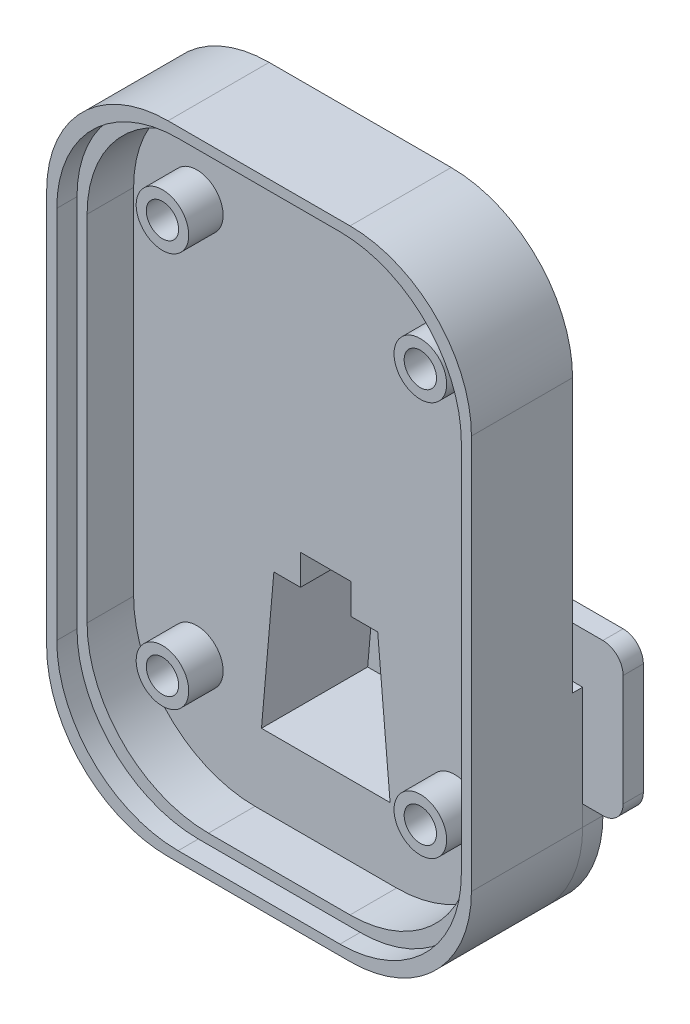
from build123d import *

# Parameters (mm, degrees)
SKETCH_2_W           = 42
SKETCH_2_H           = 63
EXTRUDE_1_DEPTH      = 10
SKETCH_3_W           = 42
SKETCH_3_H           = 24
EXTRUDE_2_DEPTH      = 8
EXTRUDE_3_DEPTH      = 32
SKETCH_5_R           = 0.74
CUT_EXTRUDE_1_DEPTH  = 10
CUT_EXTRUDE_2_DEPTH  = 7
SKETCH_8_R           = 1.6
CUT_EXTRUDE_4_DEPTH  = 3
FILLET_6_R           = 12
CUT_EXTRUDE_21_DEPTH = 7
EXTRUDE_START        = -3
SKETCH_10_R          = 1.6
EXTRUDE_9977_DEPTH   = 2
CUT_EXTRUDE_5_DEPTH  = 6.6
CUT_EXTRUDE_6_DEPTH  = 2
SKETCH_29_R          = 2.6
EXTRUDE_12_DEPTH     = 3.4
SKETCH_32_R          = 1.6
CUT_EXTRUDE_16_DEPTH = 2.4
CUT_EXTRUDE_17_DEPTH = 10.5
SKETCH_38_W          = 5
SKETCH_38_H          = 5
CUT_EXTRUDE_19_DEPTH = 3


with BuildPart() as part:
    # 草图2 → 凸台-拉伸1 (new body)
    with BuildSketch(Plane.XY):
        Rectangle(SKETCH_2_W, SKETCH_2_H)
    extrude(amount=EXTRUDE_1_DEPTH)

    # 草图3 → 凸台-拉伸2 (add)
    with BuildSketch(Plane(origin=(0, 0, 0), x_dir=(-1, 0, 0), z_dir=(0, 0, -1))):
        with Locations((0, -19.5)):
            Rectangle(SKETCH_3_W, SKETCH_3_H)
    extrude(amount=EXTRUDE_2_DEPTH)

    # 草图4 → 凸台-拉伸3 (add)
    with BuildSketch(Plane(origin=(0, -7.5, 0), x_dir=(1, 0, 0), z_dir=(0, 1, 0))):
        Polygon((3.5, 0), (4.833333333, 2), (-4.833333333, 2), (-3.5, 0), align=None)
    extrude(amount=EXTRUDE_3_DEPTH)

    # 草图5 → 切除-拉伸1 (cut)
    with BuildSketch(Plane(origin=(0, -7.5, 0), x_dir=(1, 0, 0), z_dir=(0, 1, 0))):
        with Locations(Location((-3.81, 5.25, 0), (0, 0, 270))):
            Circle(SKETCH_5_R)
        with Locations(Location((-1.27, 5.25, 0), (0, 0, 270))):
            Circle(SKETCH_5_R)
        with Locations(Location((1.27, 5.25, 0), (0, 0, 270))):
            Circle(SKETCH_5_R)
        with Locations(Location((3.81, 5.25, 0), (0, 0, 270))):
            Circle(SKETCH_5_R)
    extrude(amount=-CUT_EXTRUDE_1_DEPTH, mode=Mode.SUBTRACT)

    # 草图6 → 切除-拉伸2 (cut)
    with BuildSketch(Plane(origin=(0, 0, -8), x_dir=(-1, 0, 0), z_dir=(0, 0, -1))):
        with BuildLine():
            Line((-9.55, -7.5), (-21, -7.5))
            Line((-21, -7.5), (-21, -17.5))
            Line((-21, -17.5), (-19, -17.5))
            Line((-19, -17.5), (-19, -21.5))
            ThreePointArc((-19, -21.5), (-16.656854249, -27.156854249), (-11, -29.5))
            Line((-11, -29.5), (11, -29.5))
            ThreePointArc((11, -29.5), (16.656854249, -27.156854249), (19, -21.5))
            Line((19, -21.5), (19, -17.5))
            Line((19, -17.5), (21, -17.5))
            Line((21, -17.5), (21, -7.5))
            Line((21, -7.5), (9.55, -7.5))
            Line((9.55, -7.5), (9.55, -19.5))
            ThreePointArc((9.55, -19.5), (12.378427125, -20.671572875), (13.55, -23.5))
            ThreePointArc((13.55, -23.5), (11.55, -25.5), (9.55, -23.5))
            Line((9.55, -23.5), (-9.55, -23.5))
            ThreePointArc((-9.55, -23.5), (-11.55, -25.5), (-13.55, -23.5))
            ThreePointArc((-13.55, -23.5), (-12.378427125, -20.671572875), (-9.55, -19.5))
            Line((-9.55, -19.5), (-9.55, -7.5))
        make_face()
    extrude(amount=-CUT_EXTRUDE_2_DEPTH, mode=Mode.SUBTRACT)

    # 草图8 → 切除-拉伸4 (cut)
    with BuildSketch(Plane(origin=(0, 0, -1), x_dir=(-1, 0, 0), z_dir=(0, 0, -1))):
        with Locations((-6, -26.5)):
            Circle(SKETCH_8_R)
        with Locations((6, -26.5)):
            Circle(SKETCH_8_R)
    extrude(amount=-CUT_EXTRUDE_4_DEPTH, mode=Mode.SUBTRACT)

    # 圆角6
    fillet_6_edges = [part.edges().sort_by_distance(p)[0] for p in [
        (21, -31.5, 1),
        (-21, -31.5, 1),
        (-21, 31.5, 5),
        (21, 31.5, 5),
    ]]
    fillet(fillet_6_edges, radius=FILLET_6_R)

    # 草图43 → 切除-拉伸21 (cut)
    with BuildSketch(Plane(origin=(0, 0, -8), x_dir=(-1, 0, 0), z_dir=(0, 0, -1))):
        Polygon((-7.55, -7.5), (-21, -7.5), (-21, -31.5), (-7.55, -31.5), (-7.55, -23.5), (-6.55, -7.5), align=None)
        Polygon((21, -7.5), (21, -31.5), (7.55, -31.5), (7.55, -23.5), (6.55, -7.5), (7.55, -7.5), align=None)
    extrude(amount=-CUT_EXTRUDE_21_DEPTH, mode=Mode.SUBTRACT)

    # 草图14 → 切除-拉伸5 (cut)
    with BuildSketch(Plane.XY.offset(10)):
        with BuildLine():
            Line((-7, -29.5), (7, -29.5))
            ThreePointArc((7, -29.5), (15.485281374, -25.985281374), (19, -17.5))
            Line((19, -17.5), (19, 17.5))
            ThreePointArc((19, 17.5), (15.485281374, 25.985281374), (7, 29.5))
            Line((7, 29.5), (-7, 29.5))
            ThreePointArc((-7, 29.5), (-15.485281374, 25.985281374), (-19, 17.5))
            Line((-19, 17.5), (-19, -17.5))
            ThreePointArc((-19, -17.5), (-15.485281374, -25.985281374), (-7, -29.5))
        make_face()
    extrude(amount=-CUT_EXTRUDE_5_DEPTH, mode=Mode.SUBTRACT)

    # 草图15 → 切除-拉伸6 (cut)
    with BuildSketch(Plane.XY.offset(10)):
        with BuildLine():
            Line((-8, -30.5), (8, -30.5))
            ThreePointArc((8, -30.5), (16.485281374, -26.985281374), (20, -18.5))
            Line((20, -18.5), (20, 18.5))
            ThreePointArc((20, 18.5), (16.485281374, 26.985281374), (8, 30.5))
            Line((8, 30.5), (-8, 30.5))
            ThreePointArc((-8, 30.5), (-16.485281374, 26.985281374), (-20, 18.5))
            Line((-20, 18.5), (-20, -18.5))
            ThreePointArc((-20, -18.5), (-16.485281374, -26.985281374), (-8, -30.5))
        make_face()
    extrude(amount=-CUT_EXTRUDE_6_DEPTH, mode=Mode.SUBTRACT)

    # 草图29 → 凸台-拉伸12 (add)
    with BuildSketch(Plane.XY.offset(3.4)):
        with Locations(Location((12.75, 19.525931249, 0), (0, 0, 180))):
            Circle(SKETCH_29_R)
        with Locations(Location((-12.75, 19.525931249, 0), (0, 0, 180))):
            Circle(SKETCH_29_R)
        with Locations(Location((-12.75, -19.5, 0), (0, 0, 180))):
            Circle(SKETCH_29_R)
        with Locations(Location((12.75, -19.5, 0), (0, 0, 180))):
            Circle(SKETCH_29_R)
    extrude(amount=EXTRUDE_12_DEPTH)

    # 草图32 → 切除-拉伸16 (cut)
    with BuildSketch(Plane.XY.offset(6.8)):
        with Locations((-12.75, 19.525931249)):
            Circle(SKETCH_32_R)
        with Locations((12.75, 19.525931249)):
            Circle(SKETCH_32_R)
        with Locations((12.75, -19.5)):
            Circle(SKETCH_32_R)
        with Locations((-12.75, -19.5)):
            Circle(SKETCH_32_R)
    extrude(amount=-CUT_EXTRUDE_16_DEPTH, mode=Mode.SUBTRACT)

    # 草图36 → 切除-拉伸17 (cut)
    with BuildSketch(Plane.XY.offset(3.4)):
        Polygon((6.358510115, -22.5), (5.133668826, -8.5), (-5.133668826, -8.5), (-6.358510115, -22.5), align=None)
    extrude(amount=-CUT_EXTRUDE_17_DEPTH, mode=Mode.SUBTRACT)

    # 草图38 → 切除-拉伸19 (cut)
    with BuildSketch(Plane(origin=(0, -8.5, 0), x_dir=(-1, 0, 0), z_dir=(0, -1, 0))):
        with Locations((0, -0.9)):
            Rectangle(SKETCH_38_W, SKETCH_38_H)
    extrude(amount=-CUT_EXTRUDE_19_DEPTH, mode=Mode.SUBTRACT)


with BuildPart() as body_2:
    # 草图10 → Extrude 9977 (new body)
    with BuildSketch(Plane.XY.offset(EXTRUDE_START)):
        with BuildLine():
            Line((23, -2.5), (14.55, -2.5))
            Line((14.55, -2.5), (14.55, 1.7))
            Line((14.55, 1.7), (17.55, 1.7))
            Line((17.55, 1.7), (17.55, 2.7))
            Line((17.55, 2.7), (15.240598923, 6.7))
            Line((15.240598923, 6.7), (10.55, 6.7))
            Line((10.55, 6.7), (10.55, -17.5))
            ThreePointArc((10.55, -17.5), (14.792640687, -19.257359313), (16.55, -23.5))
            ThreePointArc((16.55, -23.5), (13.55, -26.5), (10.55, -23.5))
            Line((10.55, -23.5), (-10.55, -23.5))
            ThreePointArc((-10.55, -23.5), (-13.55, -26.5), (-16.55, -23.5))
            ThreePointArc((-16.55, -23.5), (-14.792640687, -19.257359313), (-10.55, -17.5))
            Line((-10.55, -17.5), (-10.55, 6.7))
            Line((-10.55, 6.7), (-15.240598923, 6.7))
            Line((-15.240598923, 6.7), (-17.55, 2.7))
            Line((-17.55, 2.7), (-17.55, 1.7))
            Line((-17.55, 1.7), (-14.55, 1.7))
            Line((-14.55, 1.7), (-14.55, -2.5))
            Line((-14.55, -2.5), (-23, -2.5))
            ThreePointArc((-23, -2.5), (-24.414213562, -3.085786438), (-25, -4.5))
            Line((-25, -4.5), (-25, -15.5))
            ThreePointArc((-25, -15.5), (-24.414213562, -16.914213562), (-23, -17.5))
            Line((-23, -17.5), (-21, -17.5))
            Line((-21, -17.5), (-21, -19.5))
            ThreePointArc((-21, -19.5), (-17.485281374, -27.985281374), (-9, -31.5))
            Line((-9, -31.5), (-7.55, -31.5))
            Line((-7.55, -31.5), (-7.55, -29.5))
            Line((-7.55, -29.5), (7.55, -29.5))
            Line((7.55, -29.5), (7.55, -31.5))
            Line((7.55, -31.5), (9, -31.5))
            ThreePointArc((9, -31.5), (17.485281374, -27.985281374), (21, -19.5))
            Line((21, -19.5), (21, -17.5))
            Line((21, -17.5), (23, -17.5))
            ThreePointArc((23, -17.5), (24.414213562, -16.914213562), (25, -15.5))
            Line((25, -15.5), (25, -4.5))
            ThreePointArc((25, -4.5), (24.414213562, -3.085786438), (23, -2.5))
        make_face()
        with Locations((6, -26.5)):
            Circle(SKETCH_10_R, mode=Mode.SUBTRACT)
        with Locations((-6, -26.5)):
            Circle(SKETCH_10_R, mode=Mode.SUBTRACT)
    extrude(amount=EXTRUDE_9977_DEPTH)


solid = Compound([part.part, body_2.part])
